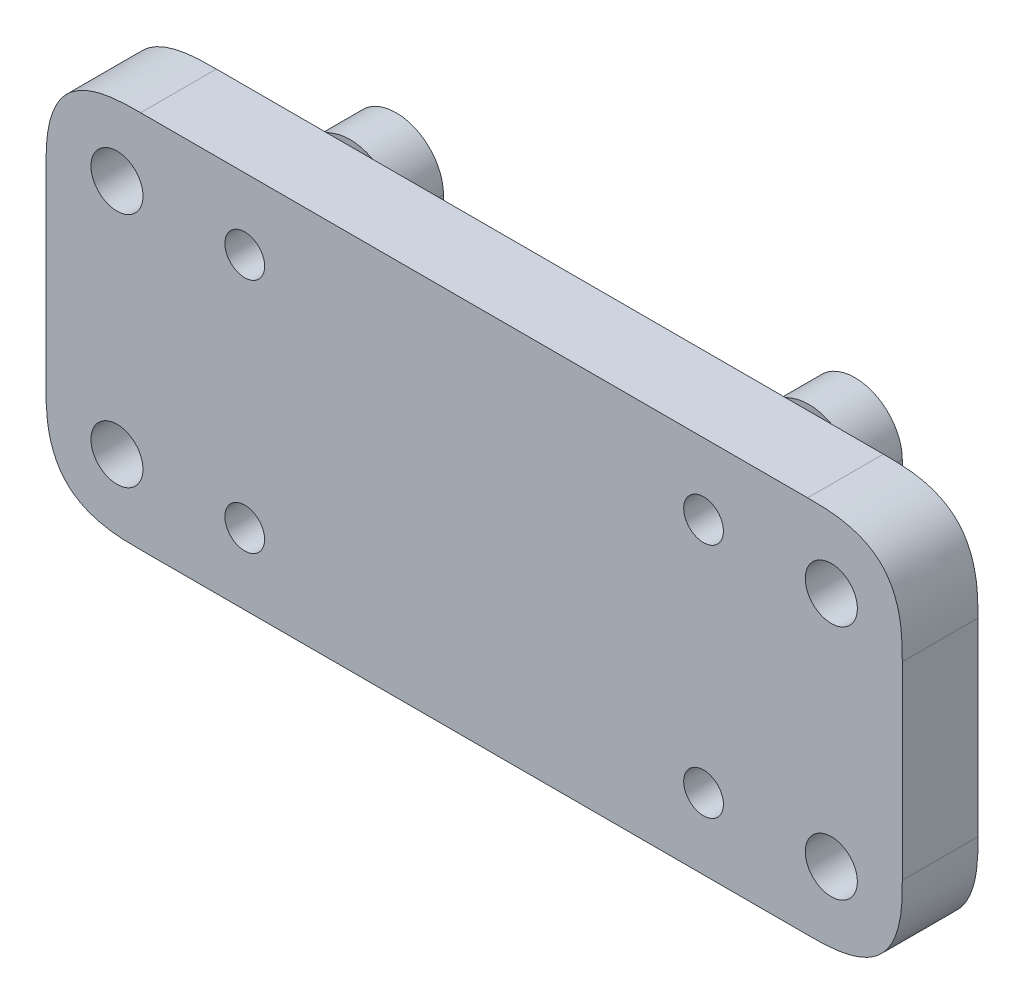
from build123d import *

# Parameters (mm, degrees)
SKETCH1_R                                    = 2.5
BOSS_EXTRUDE1_DEPTH                          = 4
BOSS_EXTRUDE1_2_DEPTH                        = 4
BOSS_EXTRUDE1_3_DEPTH                        = 4
BOSS_EXTRUDE1_4_DEPTH                        = 4
SKETCH2_W                                    = 90.48
SKETCH2_H                                    = 40
BOSS_EXTRUDE2_DEPTH                          = 8
CBORE_FOR_M5_HEX_HEAD_CAP_SCREW1_D           = 5.5
CBORE_FOR_M5_HEX_HEAD_CAP_SCREW1_CBORE_D     = 12.24
CBORE_FOR_M5_HEX_HEAD_CAP_SCREW1_CBORE_DEPTH = 3.65
F_1_16_0_0625_DIAMETER_HOLE1_D               = 1.5875
F_1_16_0_0625_DIAMETER_HOLE1_DEPTH           = 7
F_1_16_0_0625_DIAMETER_HOLE1_TIP             = 0.476933116
FILLET1_SIZE                                 = 10
BOSS_EXTRUDE3_DEPTH                          = 8
M5X0_8_TAPPED_HOLE2_D                        = 4.2
CHAMFER1_SIZE                                = 1.8
CHAMFER1_SIZE2                               = 3.117691454


with BuildPart() as part:
    # Sketch1 → Boss-Extrude1 (new body)
    with BuildSketch(Plane.XY):
        with Locations((12.75, 8.94)):
            Circle(SKETCH1_R)
    extrude(amount=BOSS_EXTRUDE1_DEPTH)



with BuildPart() as body_2:
    # Sketch1 → Boss-Extrude1 2 (new body)
    with BuildSketch(Plane.XY):
        with Locations((12.75, -8.94)):
            Circle(SKETCH1_R)
    extrude(amount=BOSS_EXTRUDE1_2_DEPTH)


with BuildPart() as body_3:
    # Sketch1 → Boss-Extrude1 3 (new body)
    with BuildSketch(Plane.XY):
        with Locations((-12.75, -8.94)):
            Circle(SKETCH1_R)
    extrude(amount=BOSS_EXTRUDE1_3_DEPTH)


with BuildPart() as body_4:
    # Sketch1 → Boss-Extrude1 4 (new body)
    with BuildSketch(Plane.XY):
        with Locations((-12.75, 8.94)):
            Circle(SKETCH1_R)
    extrude(amount=BOSS_EXTRUDE1_4_DEPTH)


with BuildPart() as part_1:
    add(part.part)

    add(body_2.part)  # Boss-Extrude2 merges body 2

    add(body_3.part)  # Boss-Extrude2 merges body 3

    add(body_4.part)  # Boss-Extrude2 merges body 4
    # Sketch2 → Boss-Extrude2 (add)
    with BuildSketch(Plane.XY.offset(4)):
        Rectangle(SKETCH2_W, SKETCH2_H)
    extrude(amount=BOSS_EXTRUDE2_DEPTH)

    # CBORE for M5 Hex Head Cap Screw1 (through all)
    with Locations(Plane(origin=(0, 0, 4), x_dir=(-1, 0, 0), z_dir=(0, 0, -1))):
        with Locations((37.74, 12.5), (-37.74, -12.5), (-37.74, 12.5), (37.74, -12.5)):
            CounterBoreHole(CBORE_FOR_M5_HEX_HEAD_CAP_SCREW1_D / 2, CBORE_FOR_M5_HEX_HEAD_CAP_SCREW1_CBORE_D / 2, CBORE_FOR_M5_HEX_HEAD_CAP_SCREW1_CBORE_DEPTH)

    # 1/16 (0.0625) Diameter Hole1
    with Locations(Plane(origin=(0, 0, 0), x_dir=(-1, 0, 0), z_dir=(0, 0, -1))):
        with Locations((-12.75, -8.94), (-12.75, 8.94), (12.75, -8.94), (12.75, 8.94)):
            Hole(F_1_16_0_0625_DIAMETER_HOLE1_D / 2, depth=F_1_16_0_0625_DIAMETER_HOLE1_DEPTH)
            with Locations((0, 0, -(F_1_16_0_0625_DIAMETER_HOLE1_DEPTH + F_1_16_0_0625_DIAMETER_HOLE1_TIP / 2))):  # 118° drill point
                Cone(0, F_1_16_0_0625_DIAMETER_HOLE1_D / 2, F_1_16_0_0625_DIAMETER_HOLE1_TIP, mode=Mode.SUBTRACT)

    # Fillet1
    # a fillet whose section is not a circle: 10 mm, written as the material it takes off along each edge
    with BuildSketch(Plane(origin=(-45.24, -20, -21), x_dir=(0, 1, 0), z_dir=(0, 0, 1)), Plane(origin=(-45.24, 20, -21), x_dir=(1, 0, 0), z_dir=(0, 0, 1))) as fillet1_piece_1:
        with BuildLine():
            add(Edge.make_bspline([(FILLET1_SIZE, 0), (FILLET1_SIZE * 0.831801948466, 0), (FILLET1_SIZE * 0.663603896932, 0), (FILLET1_SIZE * 0.292893218813, -FILLET1_SIZE * 0.0716919198361), (FILLET1_SIZE * 0.0716919198361, -FILLET1_SIZE * 0.292893218813), (0, -FILLET1_SIZE * 0.663603896932), (0, -FILLET1_SIZE * 0.831801948466), (0, -FILLET1_SIZE)], knots=[0, 0, 0, 0, 0, 0, 0.5, 0.5, 1, 1, 1, 1, 1, 1], degree=5))
            Line((0, -FILLET1_SIZE), (0, 0))
            Line((0, 0), (FILLET1_SIZE, 0))
        make_face()
    extrude(amount=58, mode=Mode.SUBTRACT)
    with BuildSketch(Plane(origin=(45.24, 20, -21), x_dir=(-1, 0, 0), z_dir=(0, 0, 1)), Plane(origin=(45.24, -20, -21), x_dir=(0, 1, 0), z_dir=(0, 0, 1))) as fillet1_piece_2:
        with BuildLine():
            add(Edge.make_bspline([(FILLET1_SIZE, 0), (FILLET1_SIZE * 0.831801948466, 0), (FILLET1_SIZE * 0.663603896932, 0), (FILLET1_SIZE * 0.292893218813, FILLET1_SIZE * 0.0716919198361), (FILLET1_SIZE * 0.0716919198361, FILLET1_SIZE * 0.292893218813), (0, FILLET1_SIZE * 0.663603896932), (0, FILLET1_SIZE * 0.831801948466), (0, FILLET1_SIZE)], knots=[0, 0, 0, 0, 0, 0, 0.5, 0.5, 1, 1, 1, 1, 1, 1], degree=5))
            Line((0, FILLET1_SIZE), (0, 0))
            Line((0, 0), (FILLET1_SIZE, 0))
        make_face()
    extrude(amount=58, mode=Mode.SUBTRACT)

    # Sketch13 → Boss-Extrude3 (add)
    with BuildSketch(Plane(origin=(0, 0, 4), x_dir=(-1, 0, 0), z_dir=(0, 0, -1))):
        with BuildLine():
            Line((-19.24, 12.5), (-19.24, -12.5))
            ThreePointArc((-19.24, -12.5), (-24.24, -17.5), (-29.24, -12.5))
            Line((-29.24, -12.5), (-29.24, 12.5))
            ThreePointArc((-29.24, 12.5), (-24.24, 17.5), (-19.24, 12.5))
        make_face()
    boss_extrude3 = extrude(amount=BOSS_EXTRUDE3_DEPTH)

    # M5x0.8 Tapped Hole2 (through all)
    with Locations(Plane(origin=(0, 0, -4), x_dir=(-1, 0, 0), z_dir=(0, 0, -1))):
        with Locations((-24.24, -12.5), (-24.24, 12.5)):
            m5x0_8_tapped_hole2 = Hole(M5X0_8_TAPPED_HOLE2_D / 2)

    # Mirror2: Boss-Extrude3, M5x0.8 Tapped Hole2 across plane
    add(boss_extrude3.mirror(Plane(origin=(0, 0, 0), x_dir=(0, 0, 1), z_dir=(1, 0, 0))))
    add(m5x0_8_tapped_hole2.mirror(Plane(origin=(0, 0, 0), x_dir=(0, 0, 1), z_dir=(1, 0, 0))), mode=Mode.SUBTRACT)

    # Chamfer1
    chamfer1_edges = [part_1.edges().sort_by_distance(p)[0] for p in [
        (24.24, 17.5, 4),
        (29.24, 0, 4),
        (24.24, -17.5, 4),
        (19.24, 0, 4),
        (-24.24, 17.5, 4),
        (-29.24, 0, 4),
        (-24.24, -17.5, 4),
        (-19.24, 0, 4),
        (10.25, -8.94, 4),
        (-15.25, -8.94, 4),
        (-15.25, 8.94, 4),
        (10.25, 8.94, 4),
    ]]
    chamfer1_side = [part_1.faces().sort_by_distance(p)[0] for p in [
        (0, -1.03e-07, 4),
    ]]
    chamfer(chamfer1_edges, length=CHAMFER1_SIZE, length2=CHAMFER1_SIZE2, reference=chamfer1_side[0])


solid = part_1.part
